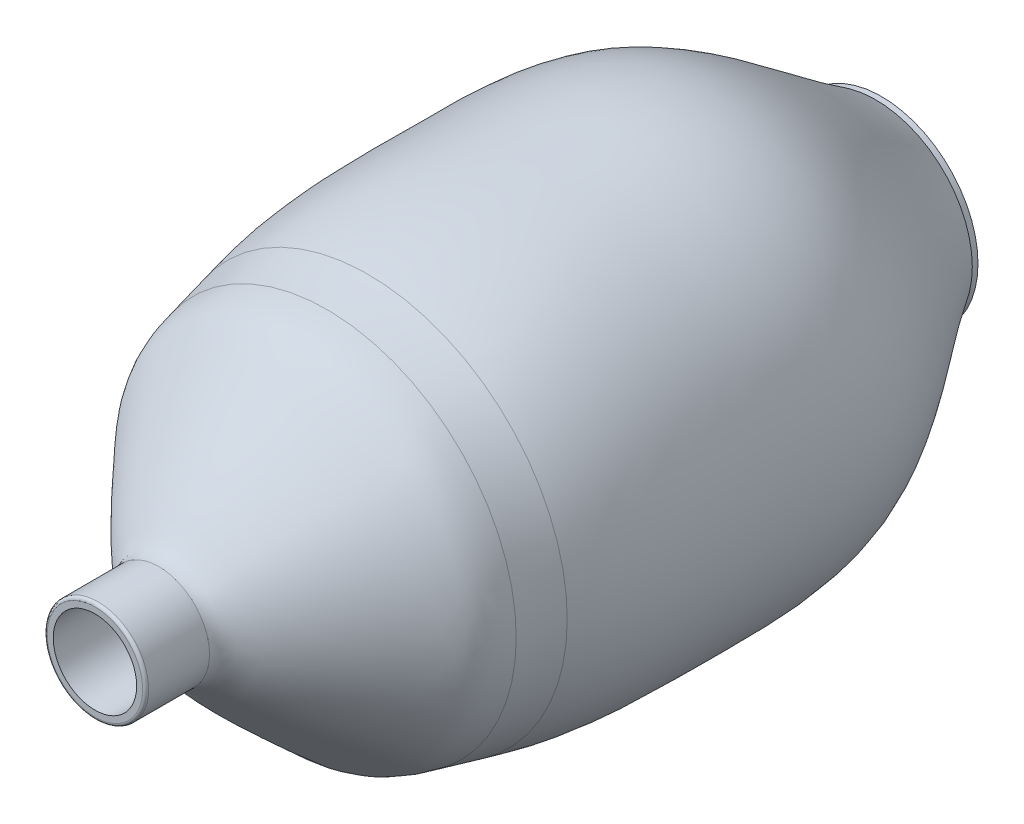
from build123d import *

# Parameters (mm, degrees)
FILLET1_R = 1
FILLET2_R = 261


with BuildPart() as part:
    # Sketch1 → Revolve1 (revolve)
    with BuildSketch(Plane(origin=(0, 0, 0), x_dir=(0, 0, -1), z_dir=(1, 0, 0)), mode=Mode.PRIVATE) as revolve1_sk:
        with BuildLine():
            Line((397.829689357, 442.030732016), (397.829689357, 437.465253038))
            Line((397.829689357, 437.465253038), (402.727304025, 437.465253038))
            Line((402.727304025, 437.465253038), (402.727304025, 443.706389044))
            Line((402.727304025, 443.706389044), (400.829689357, 443.706389044))
            add(Edge.make_bspline(
                [(225.76140421, 476.325643568), (250.097154316, 483.947478248), (288.266169539, 483.178078388), (352.940868229, 484.072298296), (383.102413409, 454.45631069), (400.829689357, 443.706389044)],
                knots=[0, 0, 0, 0, 0.382825495, 0.647952242, 1, 1, 1, 1], degree=3))
            add(Edge.make_bspline(
                [(161.570212669, 428.417840368), (165.387317703, 428.899023227), (168.912039636, 433.839023317), (180.956918186, 447.658310633), (194.029510768, 459.18780802), (209.789233312, 474.129612163), (219.574597702, 474.874030186), (225.76140421, 476.325643568)],
                knots=[0, 0, 0, 0, 0.12290588, 0.217110061, 0.671782411, 0.762907204, 1, 1, 1, 1], degree=3))
            Line((161.570212669, 428.417840368), (140.267729398, 428.417840368))
            Line((140.267729398, 428.417840368), (140.267729398, 425.417840368))
            Line((140.267729398, 425.417840368), (143.267729398, 425.417840368))
            Line((143.267729398, 425.417840368), (161.758556822, 425.417840368))
            add(Edge.make_bspline(
                [(161.758556822, 425.417840368), (161.819419658, 425.425512714), (161.923120579, 425.438145407), (162.27472043, 425.485106802), (162.818178628, 425.577931536), (163.912921631, 425.834440667), (165.908538221, 426.594243839), (168.218246537, 428.219309129), (170.253422656, 430.440677458), (171.873383547, 432.530119229), (173.443350782, 434.434741866), (175.634399053, 436.971222574), (178.464087021, 440.064030863), (181.967987343, 443.697716995), (185.564282324, 447.264008099), (189.237236912, 450.786660258), (192.970794515, 454.286260441), (196.748383607, 457.783072867), (199.920029625, 460.715970122), (202.461471471, 463.076565309), (204.3718093, 464.876742197), (206.193375261, 466.537080564), (207.988492092, 467.961738555), (209.784645287, 469.061554178), (211.812427443, 469.978689704), (214.014031173, 470.729433057), (217.153537993, 471.559261311), (221.356158221, 472.364854147), (224.841883019, 473.028424928), (226.55341987, 473.430003641)],
                knots=[-0.002005607, -0.002005607, -0.002005607, -0.002005607, -4.5902e-05, 0.001913803, 0.005833213, 0.013672034, 0.029349675, 0.060704958, 0.092060241, 0.123415523, 0.154770806, 0.186126089, 0.248836654, 0.311547219, 0.374257784, 0.436968349, 0.499678915, 0.56238948, 0.625100045, 0.656455328, 0.68781061, 0.719165893, 0.750521176, 0.781876458, 0.813231741, 0.844587023, 0.875942306, 0.938652871, 1.001363437, 1.001363437, 1.001363437, 1.001363437], degree=3))
            add(Edge.make_bspline(
                [(226.55341987, 473.430003641), (227.511334155, 473.730017583), (229.442395327, 474.313596579), (233.257020054, 475.370464775), (237.999385717, 476.518287604), (243.642274172, 477.63741249), (251.124673243, 478.823310695), (260.426034201, 479.796111148), (271.595398427, 480.356515998), (282.853796923, 480.523776333), (294.28732145, 480.496092928), (305.947870926, 480.5442697), (317.52750784, 480.329692321), (328.860803115, 479.392260986), (339.759791402, 477.348556138), (350.006050712, 473.722918078), (359.897969321, 468.470424151), (369.516520294, 462.162246785), (378.961959726, 455.277164683), (386.77531157, 449.497652391), (393.072202451, 445.099132849), (396.224580081, 443.034000768), (397.829689357, 442.030732016)],
                knots=[-0.000548601, -0.000548601, -0.000548601, -0.000548601, 0.014939032, 0.030426665, 0.061401931, 0.092377198, 0.123352464, 0.185302997, 0.24725353, 0.309204063, 0.371154595, 0.433105128, 0.495055661, 0.557006194, 0.618956726, 0.680907259, 0.742857792, 0.804808325, 0.866758858, 0.92870939, 0.959684657, 0.990659923, 0.990659923, 0.990659923, 0.990659923], degree=3))
        make_face()
    revolve(revolve1_sk.sketch.rotate(Axis((0, 411.495763099, -150.958062518), (0, 0, -1)), 90), axis=Axis((0, 411.495763099, -150.958062518), (0, 0, -1)))

    # Fillet1
    fillet1_edges = [part.edges().sort_by_distance(p)[0] for p in [
        (-16.922077268, 411.495763099, -140.267729398),
    ]]
    fillet(fillet1_edges, radius=FILLET1_R)

    # Fillet2
    # the kernel refuses this fillet: 261 mm, written as the material it adds along each edge
    with BuildSketch(Plane(origin=(0, 411.495763099, -225.76140421), x_dir=(1, 0, 0), z_dir=(0, 1, 0))) as fillet2_piece_1:
        with BuildLine():
            CenterArc((318.663368191, -61.563941431), FILLET2_R, 165.07684079, 3.104697334)
            Line((66.466358924, 5.649662228), (65.457570887, 5.918516643))
            ThreePointArc((65.457570887, 5.918516643), (64.675756472, 3.106461833), (63.833600693, 0.312029821))
            Line((63.833600693, 0.312029821), (63.813482761, 0.238477882))
            ThreePointArc((63.813482761, 0.238477882), (62.964491393, -3.853314586), (62.174322305, -7.894329204))
            Line((62.174322305, -7.894329204), (63.196191014, -8.10815236))
        make_face()
    revolve(axis=Axis((0, 411.495763099, -225.76140421), (0, 0, -1)))


solid = part.part
